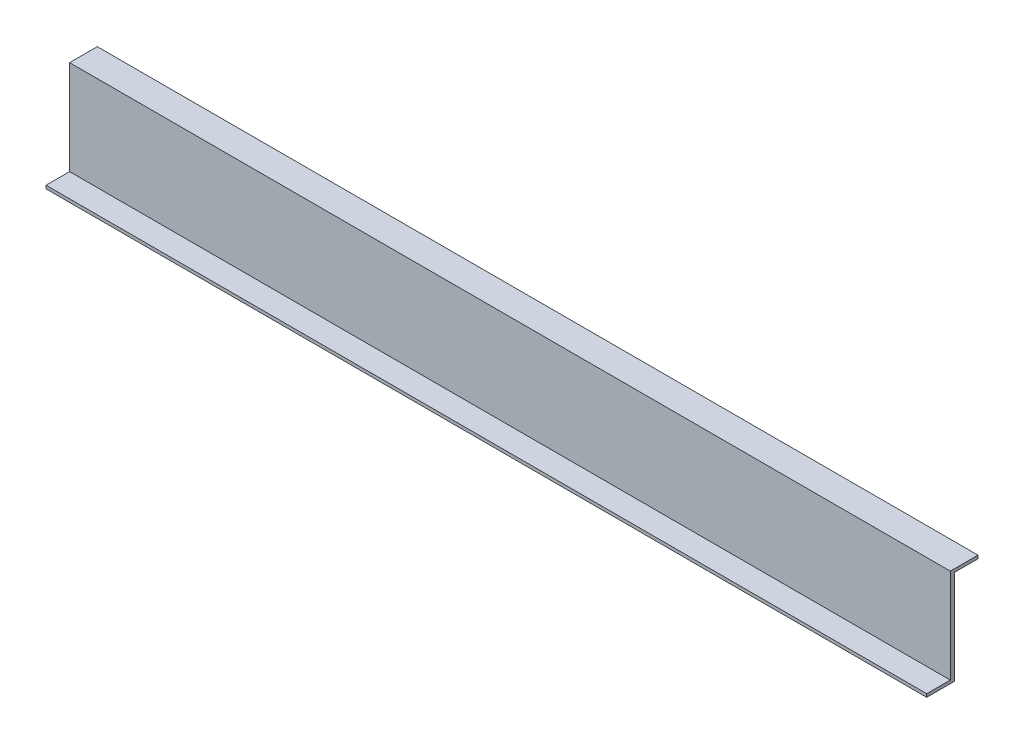
from build123d import *

# Parameters (mm, degrees)
SKETCH2_W           = 711.2
SKETCH2_H           = 78.74
BOSS_EXTRUDE1_DEPTH = 711.2
SKETCH4_W           = 19.05
SKETCH4_H           = 76.2
CUT_EXTRUDE1_DEPTH  = 1009.866129672


with BuildPart() as part:
    # Sketch2 → Boss-Extrude1 (new body)
    with BuildSketch(Plane.XY):
        with Locations((355.6, 39.37)):
            Rectangle(SKETCH2_W, SKETCH2_H)
    extrude(amount=BOSS_EXTRUDE1_DEPTH)

    # Sketch4 → Cut-Extrude1 (cut, through all)
    with BuildSketch(Plane(origin=(711.2, 0, 0), x_dir=(0, 0, -1), z_dir=(1, 0, 0))):
        with Locations((-701.675, 40.64)):
            Rectangle(SKETCH4_W, SKETCH4_H)
        Polygon((0, 78.74), (-669.798, 78.74), (-669.798, 76.2), (-688.848, 76.2), (-688.848, 0), (0, 0), align=None)
    extrude(amount=-CUT_EXTRUDE1_DEPTH, mode=Mode.SUBTRACT)


solid = part.part
